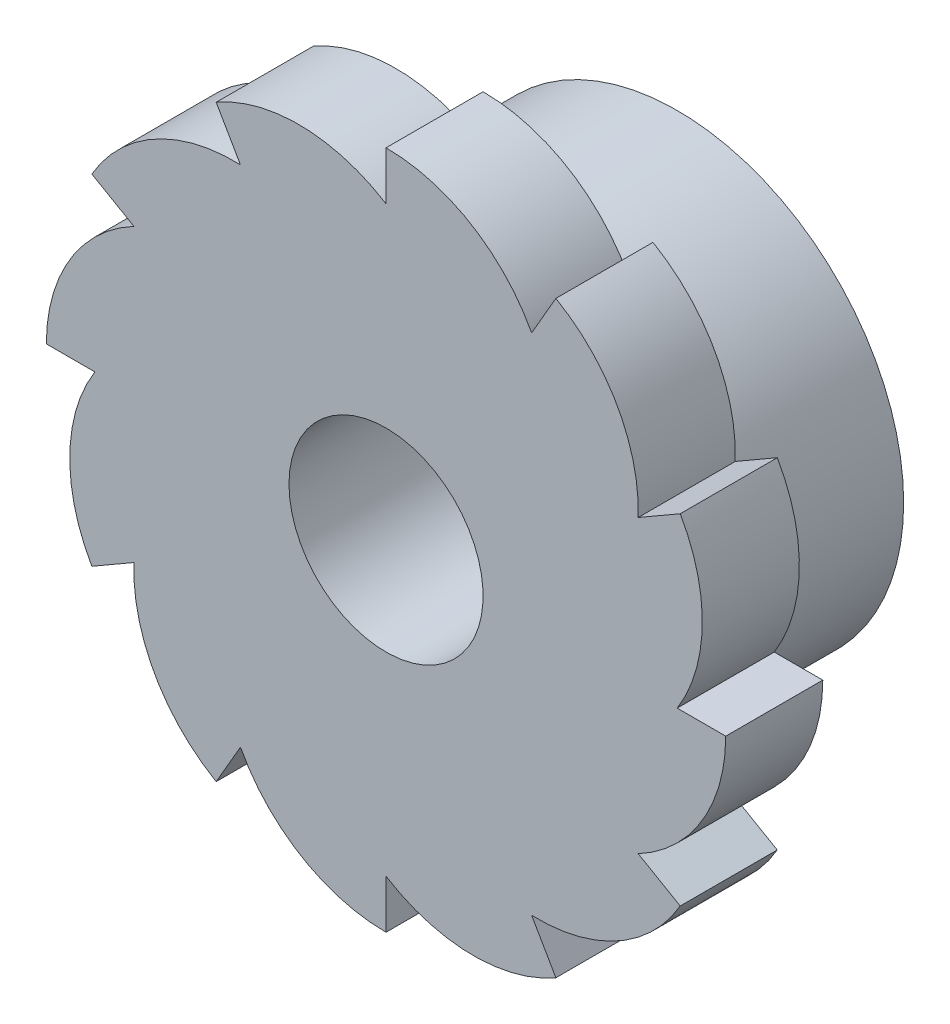
from build123d import *
from build123d.topology import SkipClean

# Parameters (mm, degrees)
BOSS_EXTRUDE1_DEPTH = 3
CIRPATTERN1_COUNT   = 12
BOSS_EXTRUDE2_START = 6
SKETCH3_R           = 3
BOSS_EXTRUDE2_DEPTH = 6
SKETCH4_R           = 1.25
CUT_EXTRUDE1_DEPTH  = 22.272047386
CUT_EXTRUDE3_REACH  = 23.272
FILLET2_R           = 0.1
FILLET3_R           = 0.3
CUT_EXTRUDE4_DEPTH  = 6


with BuildPart() as part:
    # Sketch1 → Boss-Extrude1 (new body)
    with BuildSketch(Plane.XY):
        with BuildLine():
            Line((0, 9), (0, 10.5))
            ThreePointArc((0, 10.5), (2.62541419, 9.771470047), (4.5, 7.794228634))
            Line((4.5, 7.794228634), (1.5, 2.598076211))
            ThreePointArc((1.5, 2.598076211), (0.776457135, 2.897777479), (0, 3))
            Line((0, 3), (0, 9))
        make_face()
    boss_extrude1 = extrude(amount=BOSS_EXTRUDE1_DEPTH)

    # CirPattern1: Boss-Extrude1 ×12 about axis
    cirpattern1_axis = Axis((0, 0, 0), (0, 0, 1))
    for i in range(1, CIRPATTERN1_COUNT):
        add(boss_extrude1.rotate(cirpattern1_axis, i * 360 / CIRPATTERN1_COUNT))

    # Sketch3 → Boss-Extrude2 (add)
    with SkipClean():  # the faces are left unmerged after this step: merging them gives an invalid solid
        with BuildSketch(Plane(origin=(0, 0, 0), x_dir=(-1, 0, 0), z_dir=(0, 0, -1)).offset(BOSS_EXTRUDE2_START)):
            with BuildLine():
                Line((7, 0), (7, -7))
                Line((7, -7), (0, -7))
                ThreePointArc((0, -7), (-4.949747468, -4.949747468), (-7, 0))
                Line((-7, 0), (-7, 7))
                Line((-7, 7), (7, 7))
                Line((7, 7), (7, 0))
            make_face()
            Circle(SKETCH3_R, mode=Mode.SUBTRACT)
        extrude(amount=-BOSS_EXTRUDE2_DEPTH)

    # Sketch4 → Cut-Extrude1 (cut, through all)
    with SkipClean():  # the faces are left unmerged after this step: merging them gives an invalid solid
        with BuildSketch(Plane(origin=(0, 7, 0), x_dir=(1, 0, 0), z_dir=(0, 1, 0))):
            with Locations(Location((-5, 3, 0), (0, 0, 270))):
                Circle(SKETCH4_R)
        extrude(amount=-CUT_EXTRUDE1_DEPTH, mode=Mode.SUBTRACT)

    # Sketch6 → Cut-Extrude3 (cut, up to next)
    with BuildSketch(Plane.ZY.offset(7), mode=Mode.PRIVATE) as cut_extrude3_sk1:
        Polygon((-6, -0.2), (-6, 0.2), (-2.5, 0.2), (-2.5, 0.4), (-0.5, 0.4), (-0.5, -0.4), (-2.5, -0.4), (-2.5, -0.2), align=None)
    cut_extrude3_tool1 = extrude(cut_extrude3_sk1.sketch, amount=-CUT_EXTRUDE3_REACH, mode=Mode.PRIVATE) & part.part
    add(cut_extrude3_tool1.solids().sort_by_distance((-7, 0, -2.783333))[0], mode=Mode.SUBTRACT)

    # Fillet2
    fillet2_edges = [part.edges().sort_by_distance(p)[0] for p in [
        (-6.572821962, 0.4, -2.5),
        (-3.423840993, 0.2, -2.5),
        (-3.413784913, 0.4, -2.5),
        (-6.572821962, 0.2, -2.5),
        (-3.413784913, -0.4, -2.5),
        (-3.423840993, -0.2, -2.5),
        (-6.572821962, -0.4, -2.5),
        (-6.572821962, -0.2, -2.5),
    ]]
    fillet(fillet2_edges, radius=FILLET2_R - 0.0001)  # a hair under: the kernel refuses the full size

    # Fillet3
    fillet3_edges = [part.edges().sort_by_distance(p)[0] for p in [
        (-4.986606875, 0.4, -0.5),
        (-4.986606875, -0.4, -0.5),
    ]]
    fillet(fillet3_edges, radius=FILLET3_R)

    # Sketch7 → Cut-Extrude4 (cut)
    with SkipClean():  # the faces are left unmerged after this step: merging them gives an invalid solid
        with BuildSketch(Plane(origin=(0, 0, -6), x_dir=(-1, 0, 0), z_dir=(0, 0, -1))):
            with BuildLine():
                Line((0, 7), (-7, 7))
                Line((-7, 7), (-7, 0))
                ThreePointArc((-7, 0), (-4.949747468, 4.949747468), (0, 7))
            make_face()
            with BuildLine():
                Line((7, 7), (0, 7))
                ThreePointArc((0, 7), (4.878524367, 5.019960159), (6.997142274, 0.2))
                Line((6.997142274, 0.2), (7, 0.2))
                Line((7, 0.2), (7, 7))
            make_face()
            with BuildLine():
                Line((7, -7), (7, -0.2))
                Line((7, -0.2), (6.997142274, -0.2))
                ThreePointArc((6.997142274, -0.2), (4.878524367, -5.019960159), (0, -7))
                Line((0, -7), (7, -7))
            make_face()
        extrude(amount=-CUT_EXTRUDE4_DEPTH, mode=Mode.SUBTRACT)


solid = part.part
